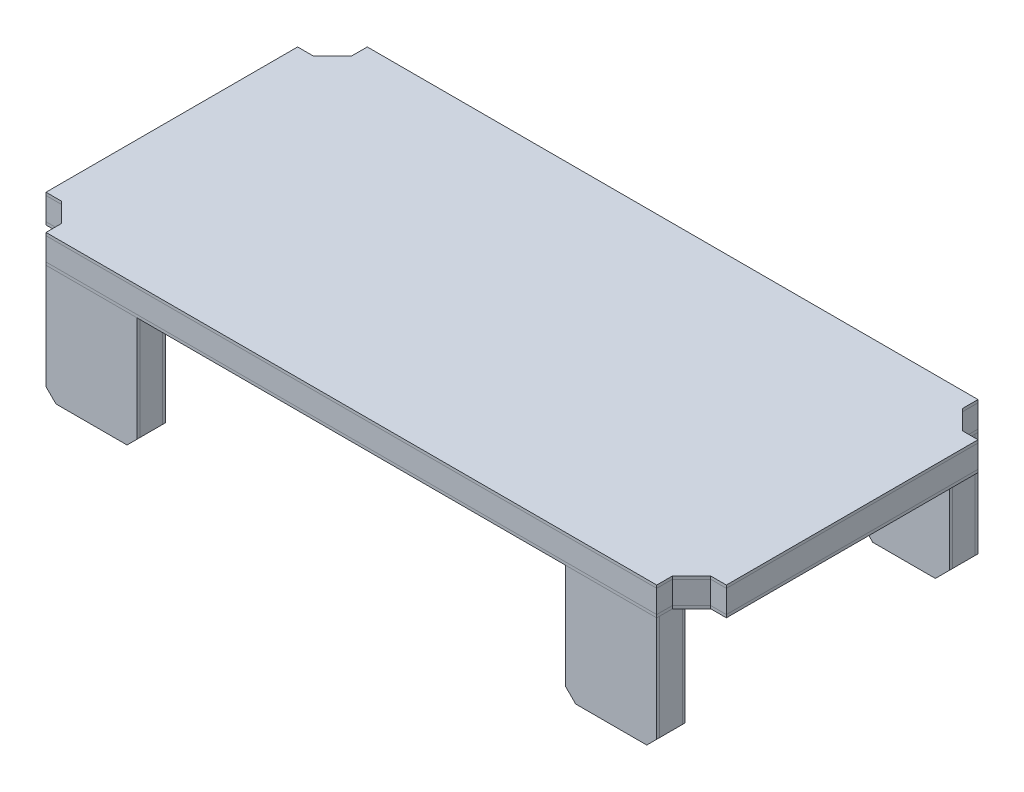
from build123d import *

# Parameters (mm, degrees)
BOSS_EXTRUDE1_START  = 4
SKETCH3_W            = 239.3
SKETCH3_H            = 113
BOSS_EXTRUDE1_DEPTH  = 1
BOSS_EXTRUDE2_START  = -4
SKETCH3_2_W          = 239.3
SKETCH3_2_H          = 113
BOSS_EXTRUDE2_DEPTH  = 8
CUT_EXTRUDE1_DEPTH   = 133.413641669
MIRROR6_COPY_1_DEPTH = 133.413641669
SKETCH4_W            = 32
SKETCH4_H            = 1
BOSS_EXTRUDE3_DEPTH  = 42
CHAMFER1_SIZE        = 5
BOSS_EXTRUDE4_DEPTH  = 8
BOSS_EXTRUDE5_DEPTH  = 1
CHAMFER2_SIZE        = 1.5
CHAMFER3_SIZE        = 0.5


with BuildPart() as part:
    # Sketch3 → Boss-Extrude1 (new body)
    with BuildSketch(Plane(origin=(0, 0, 0), x_dir=(1, 0, 0), z_dir=(0, 1, 0)).offset(BOSS_EXTRUDE1_START)):
        Rectangle(SKETCH3_W, SKETCH3_H)
    extrude(amount=BOSS_EXTRUDE1_DEPTH)


with BuildPart() as body_2:
    # Mirror3: mirrored copy
    add(part.part.mirror(Plane.ZX))


with BuildPart() as body_3:
    # Sketch3<2> → Boss-Extrude2 (new body)
    with BuildSketch(Plane(origin=(0, 0, 0), x_dir=(1, 0, 0), z_dir=(0, 1, 0)).offset(BOSS_EXTRUDE2_START)):
        Rectangle(SKETCH3_2_W, SKETCH3_2_H)
    extrude(amount=BOSS_EXTRUDE2_DEPTH)


with BuildPart() as cut_extrude1_tool:
    # Sketch2 → Cut-Extrude1 (new, symmetric)
    with BuildSketch(Plane(origin=(0, 0, 0), x_dir=(1, 0, 0), z_dir=(0, 1, 0))):
        Polygon((-110.4, 57), (-107.4, 57), (-107.4, 51), (-114.15, 44.25), (-120.15, 44.25), (-120.15, 47.25), (-120.15, 57), align=None)
    cut_extrude1 = extrude(amount=CUT_EXTRUDE1_DEPTH, both=True)


with BuildPart() as part_1:
    add(part.part)

    # Cut-Extrude1: cut by cut_extrude1_tool
    add(cut_extrude1_tool.part, mode=Mode.SUBTRACT)


with BuildPart() as body_2_1:
    add(body_2.part)

    # Cut-Extrude1: cut by cut_extrude1_tool
    add(cut_extrude1_tool.part, mode=Mode.SUBTRACT)


with BuildPart() as body_3_1:
    add(body_3.part)

    # Cut-Extrude1: cut by cut_extrude1_tool
    add(cut_extrude1_tool.part, mode=Mode.SUBTRACT)


with BuildPart() as mirror5_tool:
    # Mirror5: Cut-Extrude1 across plane
    add(cut_extrude1.mirror(Plane.XY))


with BuildPart() as part_2:
    add(part_1.part)

    # Mirror5: cut by mirror5_tool
    add(mirror5_tool.part, mode=Mode.SUBTRACT)


with BuildPart() as body_2_2:
    add(body_2_1.part)

    # Mirror5: cut by mirror5_tool
    add(mirror5_tool.part, mode=Mode.SUBTRACT)


with BuildPart() as body_3_2:
    add(body_3_1.part)

    # Mirror5: cut by mirror5_tool
    add(mirror5_tool.part, mode=Mode.SUBTRACT)


with BuildPart() as mirror6_tool:
    # Mirror6: Cut-Extrude1 across plane
    add(cut_extrude1.mirror(Plane(origin=(0, 0, 0), x_dir=(0, 0, 1), z_dir=(1, 0, 0))))


with BuildPart() as part_3:
    add(part_2.part)

    # Mirror6: cut by mirror6_tool
    add(mirror6_tool.part, mode=Mode.SUBTRACT)


with BuildPart() as body_2_3:
    add(body_2_2.part)

    # Mirror6: cut by mirror6_tool
    add(mirror6_tool.part, mode=Mode.SUBTRACT)


with BuildPart() as body_3_3:
    add(body_3_2.part)

    # Mirror6: cut by mirror6_tool
    add(mirror6_tool.part, mode=Mode.SUBTRACT)


with BuildPart() as mirror6_copy_1_tool:
    # Mirror6 copy 1 sketch → Mirror6 copy 1 (new, symmetric)
    with BuildSketch(Plane(origin=(0, 0, 0), x_dir=(-1, 0, 0), z_dir=(0, 1, 0))):
        Polygon((-110.4, 57), (-107.4, 57), (-107.4, 51), (-114.15, 44.25), (-120.15, 44.25), (-120.15, 47.25), (-120.15, 57), align=None)
    extrude(amount=MIRROR6_COPY_1_DEPTH, both=True)


with BuildPart() as part_4:
    add(part_3.part)

    # Mirror6 copy 1: cut by mirror6_copy_1_tool
    add(mirror6_copy_1_tool.part, mode=Mode.SUBTRACT)


with BuildPart() as body_2_4:
    add(body_2_3.part)

    # Mirror6 copy 1: cut by mirror6_copy_1_tool
    add(mirror6_copy_1_tool.part, mode=Mode.SUBTRACT)


with BuildPart() as body_3_4:
    add(body_3_3.part)

    # Mirror6 copy 1: cut by mirror6_copy_1_tool
    add(mirror6_copy_1_tool.part, mode=Mode.SUBTRACT)


with BuildPart() as body_4:
    # Sketch4 → Boss-Extrude3 (new body)
    with BuildSketch(Plane.XZ.offset(5)):
        with Locations((-91.4, 56)):
            Rectangle(SKETCH4_W, SKETCH4_H)
    extrude(amount=BOSS_EXTRUDE3_DEPTH)

    # Chamfer1
    chamfer1_edges = [body_4.edges().sort_by_distance(p)[0] for p in [
        (-75.4, -47, 56),
        (-107.4, -47, 56),
    ]]
    chamfer(chamfer1_edges, length=CHAMFER1_SIZE)

    # Chamfer2
    # the kernel refuses this chamfer: 1.5 mm, written as the material it takes off along each edge
    with BuildSketch(Plane(origin=(-106.257524482, -47, 56.5), x_dir=(0, 0.9996219169112965, 0.02749587661058676), z_dir=(1, 0, 0))) as chamfer2_piece_1:
        Polygon((CHAMFER2_SIZE * 0.999621916911, -CHAMFER2_SIZE * 0.0274958766106), (-CHAMFER2_SIZE * 0.0274958766106, -CHAMFER2_SIZE * 0.999621916911), (0, 0), align=None)
    extrude(amount=29.715048964, mode=Mode.SUBTRACT)


with BuildPart() as body_5:
    # Sketch6 → Boss-Extrude4 (new body)
    with BuildSketch(Plane(origin=(0, 0, 55.5), x_dir=(-1, 0, 0), z_dir=(0, 0, -1))):
        Polygon((107.4, -5), (75.4, -5), (75.4, -42), (80.4, -47), (102.4, -47), (107.4, -42), align=None)
    extrude(amount=BOSS_EXTRUDE4_DEPTH)

    # Chamfer3
    chamfer3_edges = [body_5.edges().sort_by_distance(p)[0] for p in [
        (-91.4, -47, 55.5),
    ]]
    chamfer(chamfer3_edges, length=CHAMFER3_SIZE)


with BuildPart() as body_6:
    # Sketch7 → Boss-Extrude5 (new body)
    with BuildSketch(Plane(origin=(0, 0, 47.5), x_dir=(-1, 0, 0), z_dir=(0, 0, -1))):
        Polygon((107.4, -42), (107.4, -5), (75.4, -5), (75.4, -42), (80.4, -47), (102.4, -47), align=None)
    extrude(amount=BOSS_EXTRUDE5_DEPTH)


with BuildPart() as body_7:
    # Mirror7: mirrored copy
    add(body_6.part.mirror(Plane.XY))


with BuildPart() as body_8:
    # Mirror7 2: mirrored copy
    add(body_5.part.mirror(Plane.XY))


with BuildPart() as body_9:
    # Mirror7 3: mirrored copy
    add(body_4.part.mirror(Plane.XY))


with BuildPart() as body_10:
    # Mirror8: mirrored copy
    add(body_9.part.mirror(Plane(origin=(0, 0, 0), x_dir=(0, 0, 1), z_dir=(1, 0, 0))))


with BuildPart() as body_11:
    # Mirror8 2: mirrored copy
    add(body_8.part.mirror(Plane(origin=(0, 0, 0), x_dir=(0, 0, 1), z_dir=(1, 0, 0))))


with BuildPart() as body_12:
    # Mirror8 3: mirrored copy
    add(body_6.part.mirror(Plane(origin=(0, 0, 0), x_dir=(0, 0, 1), z_dir=(1, 0, 0))))


with BuildPart() as body_13:
    # Mirror8 4: mirrored copy
    add(body_5.part.mirror(Plane(origin=(0, 0, 0), x_dir=(0, 0, 1), z_dir=(1, 0, 0))))


with BuildPart() as body_14:
    # Mirror8 5: mirrored copy
    add(body_7.part.mirror(Plane(origin=(0, 0, 0), x_dir=(0, 0, 1), z_dir=(1, 0, 0))))


with BuildPart() as body_15:
    # Mirror8 6: mirrored copy
    add(body_4.part.mirror(Plane(origin=(0, 0, 0), x_dir=(0, 0, 1), z_dir=(1, 0, 0))))


solid = Compound([part_4.part, body_2_4.part, body_3_4.part, body_4.part, body_5.part, body_6.part, body_7.part, body_8.part, body_9.part, body_10.part, body_11.part, body_12.part, body_13.part, body_14.part, body_15.part])
